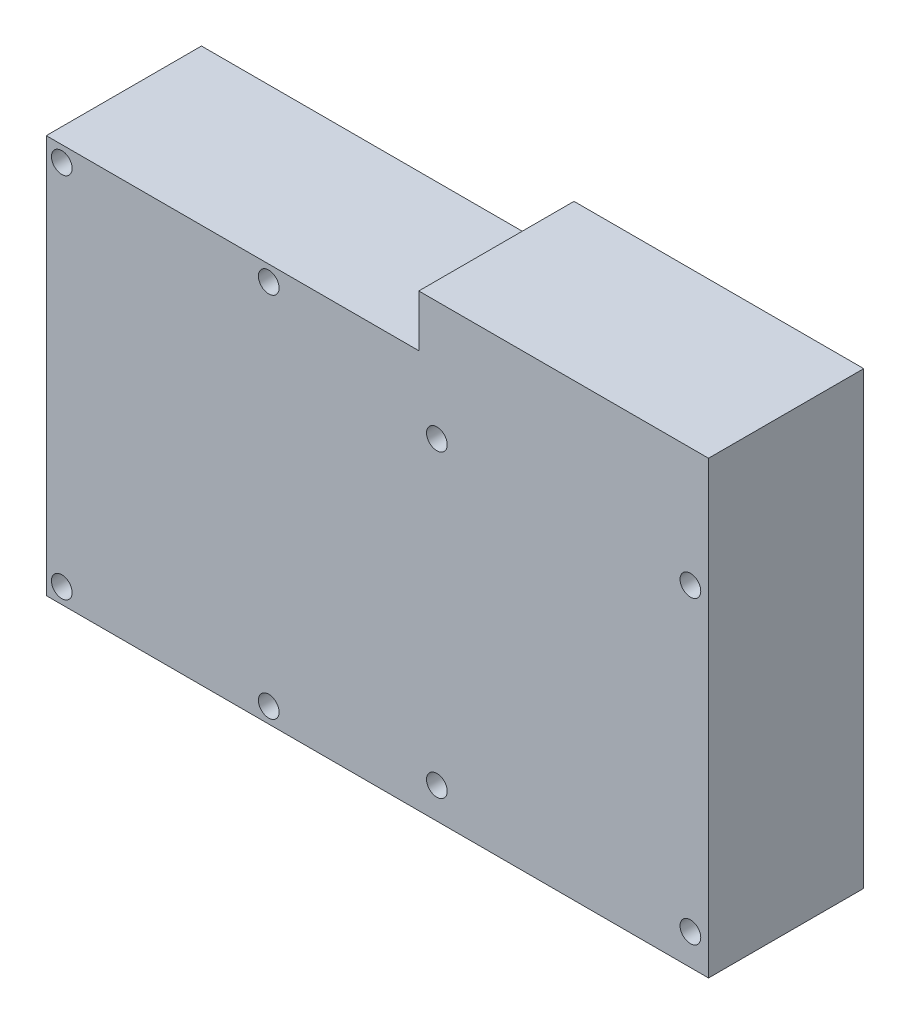
from build123d import *

# Parameters (mm, degrees)
ESQUISSE1_R        = 2
BOSS_EXTRU_1_DEPTH = 30


with BuildPart() as part:
    # Esquisse1 → Boss.-Extru.1 (new body)
    with BuildSketch(Plane.XY):
        Polygon((0, 0), (128, 0), (128, 87), (72, 87), (72, 77), (0, 77), align=None)
        with Locations((3, 74)):
            Circle(ESQUISSE1_R, mode=Mode.SUBTRACT)
        with Locations((43, 74)):
            Circle(ESQUISSE1_R, mode=Mode.SUBTRACT)
        with Locations((3, 3)):
            Circle(ESQUISSE1_R, mode=Mode.SUBTRACT)
        with Locations((43, 3)):
            Circle(ESQUISSE1_R, mode=Mode.SUBTRACT)
        with Locations((75.5, 64)):
            Circle(ESQUISSE1_R, mode=Mode.SUBTRACT)
        with Locations((124.5, 64)):
            Circle(ESQUISSE1_R, mode=Mode.SUBTRACT)
        with Locations((75.5, 6)):
            Circle(ESQUISSE1_R, mode=Mode.SUBTRACT)
        with Locations((124.5, 6)):
            Circle(ESQUISSE1_R, mode=Mode.SUBTRACT)
    extrude(amount=-BOSS_EXTRU_1_DEPTH)


solid = part.part
